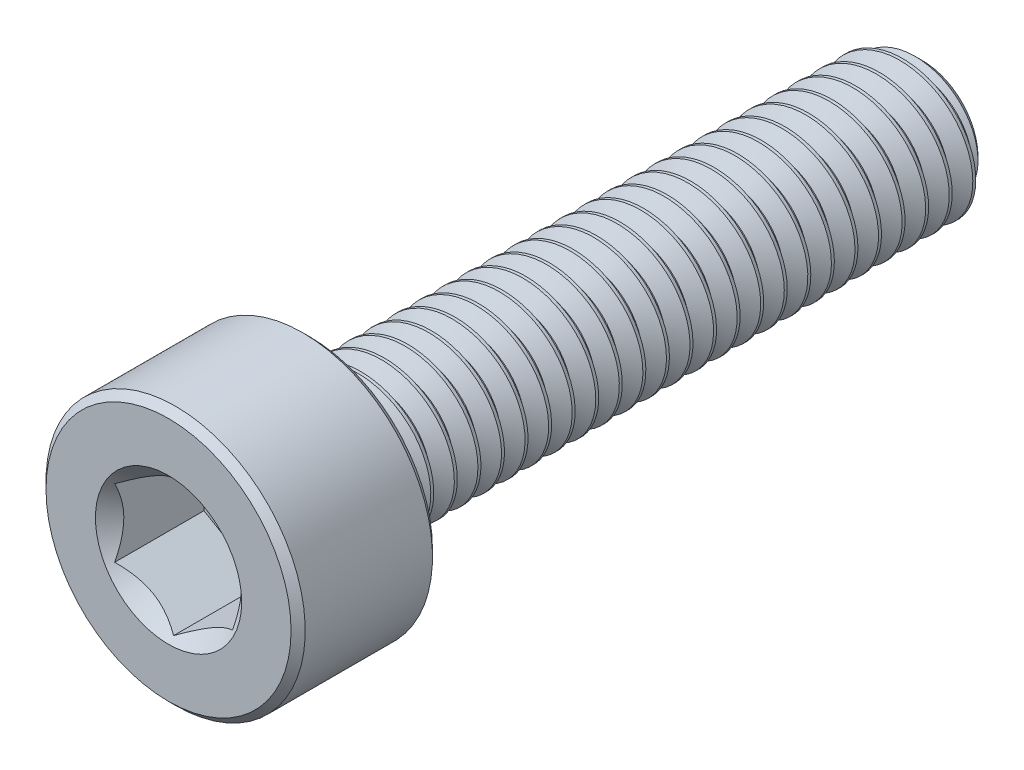
from build123d import *

# Parameters (mm, degrees)
CUT_EXTRUDE1_DEPTH     = 2
SKETCH4_R              = 1.551628848
CUT_EXTRUDE2_DEPTH     = 1.5
CUT_EXTRUDE2_DRAFT     = -45
SPLIT1_SURFACE_1_BACK  = 18.79
SPLIT1_SURFACE_1_DEPTH = 37.58
SPLIT1_SURFACE_2_BACK  = 18.79
SPLIT1_SURFACE_2_DEPTH = 37.58
CUT_SWEEP1_PITCH       = 0.5


with BuildPart() as part:
    # Sketch2 → Revolve1 (revolve)
    with BuildSketch(Plane(origin=(0, 0, 0), x_dir=(0, 0, -1), z_dir=(1, 0, 0))):
        with BuildLine():
            Line((-8, 0), (-8, 2.6))
            Line((-8, 2.6), (-7.85, 2.75))
            Line((-7.85, 2.75), (-5.15, 2.75))
            Line((-5.15, 2.75), (-5, 2.6))
            Line((-5, 2.6), (-5, 1.65))
            ThreePointArc((-5, 1.65), (-4.956066017, 1.543933983), (-4.85, 1.5))
            Line((-4.85, 1.5), (7.675240474, 1.5))
            Line((7.675240474, 1.5), (8, 1.175240474))
            Line((8, 1.175240474), (8, 0))
            Line((8, 0), (-8, 0))
        make_face()
    revolve(axis=Axis((0, 0, -8), (0, 0, 1)))

    # Sketch3 → Cut-Extrude1 (cut)
    with BuildSketch(Plane.XY.offset(8)):
        Polygon((1.25, -0.721687836), (1.25, 0.721687836), (0, 1.443375673), (-1.25, 0.721687836), (-1.25, -0.721687836), (0, -1.443375673), align=None)
    extrude(amount=-CUT_EXTRUDE1_DEPTH, mode=Mode.SUBTRACT)


with BuildPart() as cut_extrude2_tool:
    # Sketch4 → Cut-Extrude2 (with draft: the straight prism first)
    with BuildSketch(Plane.XY.offset(8)):
        Circle(SKETCH4_R)
    extrude(amount=-CUT_EXTRUDE2_DEPTH)
    # Cut-Extrude2: the draft: its side faces are tilted about the plane it starts from
    cut_extrude2_sides = [cut_extrude2_tool.faces().sort_by_distance(p)[0] for p in [
        (-1.551628848, 0, 7.25),
    ]]
    draft(cut_extrude2_sides, Plane.XY.offset(8), CUT_EXTRUDE2_DRAFT)


with BuildPart() as part_1:
    add(part.part)

    # Cut-Extrude2: cut by cut_extrude2_tool
    add(cut_extrude2_tool.part, mode=Mode.SUBTRACT)


with BuildPart() as body_2:
    # Split1: the piece behind the surface
    add(part_1.part)
    # Split1 surface: a surface, the sketch's curves swept straight by 37.58 mm
    with BuildLine(Plane(origin=(0, 0, 0), x_dir=(0, 0, -1), z_dir=(1, 0, 0)).offset(-SPLIT1_SURFACE_1_BACK), mode=Mode.PRIVATE) as split1_surface_1_path:
        Line((-4.85, -2.75), (-4.85, 2.75))
    split1_surface_1 = Shell.extrude(split1_surface_1_path.wire(), (1 * SPLIT1_SURFACE_1_DEPTH, 0 * SPLIT1_SURFACE_1_DEPTH, 0 * SPLIT1_SURFACE_1_DEPTH))
    split(bisect_by=split1_surface_1, keep=Keep.BOTTOM)

    # Cut-Sweep1: the profile of Sketch7 screwed along a right-hand helix of 27 turns, 6 arcs to a turn; built about Z, then put on its axis
    cut_sweep1_z = Axis((0, 0, 0), (0, 0, 1))
    cut_sweep1_corners = [(1.527063294, 0, 0.015625), (1.527063294, 0, -0.453125), (1.175240474, 0, -0.25), (1.175240474, 0, -0.1875)]
    with BuildLine(mode=Mode.PRIVATE) as cut_sweep1_profile:
        Line(cut_sweep1_corners[0], cut_sweep1_corners[1])
        Line(cut_sweep1_corners[1], cut_sweep1_corners[2])
        Line(cut_sweep1_corners[2], cut_sweep1_corners[3])
        Line(cut_sweep1_corners[3], cut_sweep1_corners[0])
    cut_sweep1_cap = Face(cut_sweep1_profile.wire())
    cut_sweep1_turn_angles = [0, 30, 60, 90, 120, 150, 180, 210, 240, 270, 300, 330, 360]
    cut_sweep1_turn_weights = [1, 0.8660254037844387, 1, 0.8660254037844387, 1, 0.8660254037844387, 1, 0.8660254037844387, 1, 0.8660254037844387, 1, 0.8660254037844387, 1]
    cut_sweep1_turn_rails = [Edge.make_bspline([Vector(p[0], p[1], 0).rotate(cut_sweep1_z, cut_sweep1_turn_angles[k]) / cut_sweep1_turn_weights[k] + Vector(0, 0, p[2] + CUT_SWEEP1_PITCH * cut_sweep1_turn_angles[k] / 360) for k in range(13)], [0, 0, 0, 1, 1, 2, 2, 3, 3, 4, 4, 5, 5, 6, 6, 6], 2, cut_sweep1_turn_weights) for p in cut_sweep1_corners]
    cut_sweep1_turn_sides = [Face.make_surface_from_curves(cut_sweep1_turn_rails[p[0]], cut_sweep1_turn_rails[p[1]]) for p in [(0, 1), (1, 2), (2, 3), (3, 0)]]
    cut_sweep1 = Plane(origin=(0, 0, -8), x_dir=(0, 1, 0), z_dir=(0, 0, 1)) * Solid(Shell([*[p.moved(Location((0, 0, CUT_SWEEP1_PITCH * i))) for i in range(27) for p in cut_sweep1_turn_sides], cut_sweep1_cap, cut_sweep1_cap.rotate(cut_sweep1_z, 9720).moved(Location((0, 0, CUT_SWEEP1_PITCH * 9720 / 360)))]))
    add(cut_sweep1, mode=Mode.SUBTRACT)


with BuildPart() as part_2:
    add(part_1.part)

    # Split1: split by a surface, the side it looks to stays
    # Split1 surface: a surface, the sketch's curves swept straight by 37.58 mm
    with BuildLine(Plane(origin=(0, 0, 0), x_dir=(0, 0, -1), z_dir=(1, 0, 0)).offset(-SPLIT1_SURFACE_2_BACK), mode=Mode.PRIVATE) as split1_surface_2_path:
        Line((-4.85, -2.75), (-4.85, 2.75))
    split1_surface_2 = Shell.extrude(split1_surface_2_path.wire(), (1 * SPLIT1_SURFACE_2_DEPTH, 0 * SPLIT1_SURFACE_2_DEPTH, 0 * SPLIT1_SURFACE_2_DEPTH))
    split(bisect_by=split1_surface_2, keep=Keep.TOP)

    add(body_2.part)  # Revolve2 merges body 2
    # Sketch8 → Revolve2 (revolve)
    with BuildSketch(Plane(origin=(0, 0, 0), x_dir=(0, 0, -1), z_dir=(1, 0, 0))):
        Polygon((-5, 0), (-5, 1.5), (-4.85, 1.5), (-3.983974596, 0), align=None)
    revolve(axis=Axis((0, 0, 3.983974596), (0, 0, 1)))


solid = part_2.part
